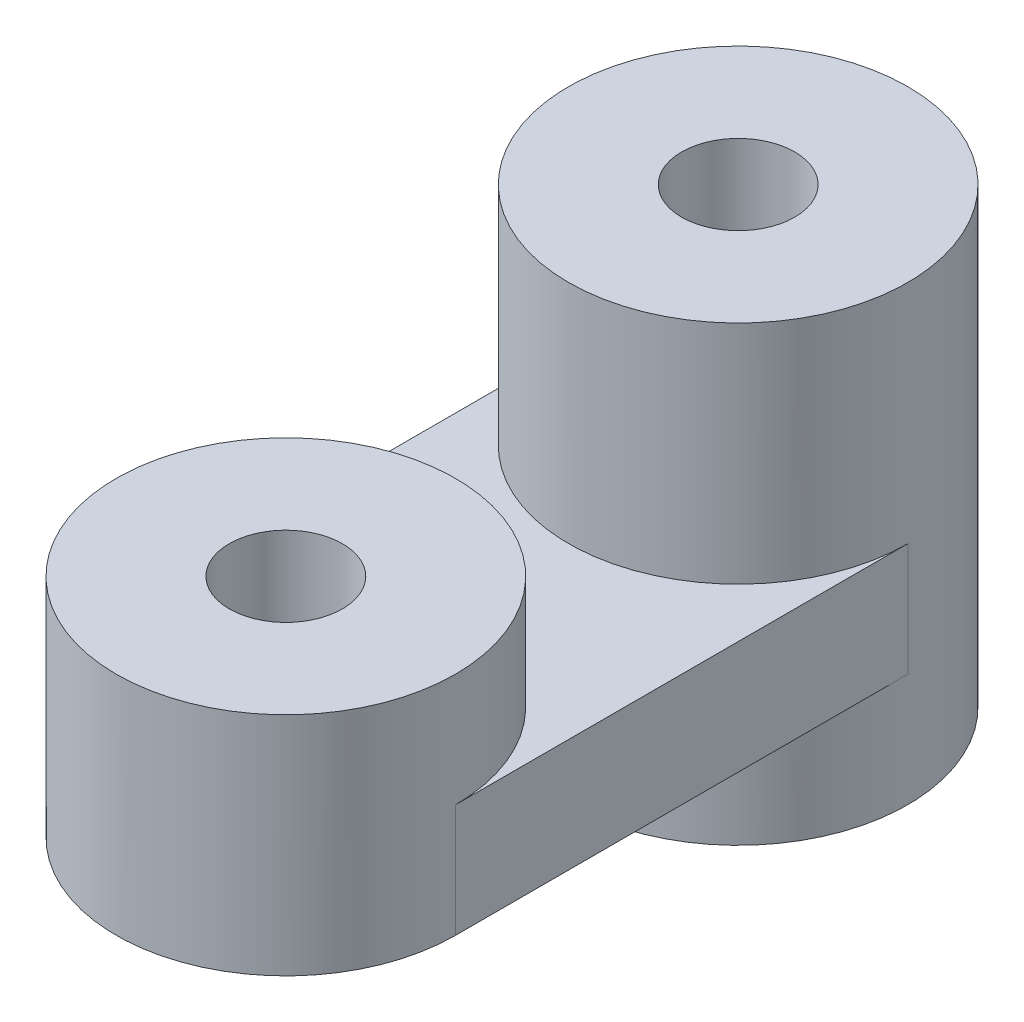
from build123d import *
from build123d.topology import SkipClean

# Parameters (mm, degrees)
CROQUIS1_R              = 2.5
SALIENTE_EXTRUIR1_DEPTH = 5
CROQUIS2_R              = 7.5
CROQUIS2_R_2            = 2.5
SALIENTE_EXTRUIR2_DEPTH = 5
CROQUIS3_R              = 7.5
CROQUIS3_R_2            = 2.5
SALIENTE_EXTRUIR3_DEPTH = 5
SALIENTE_EXTRUIR4_START = 5
CROQUIS4_R              = 2.5
SALIENTE_EXTRUIR4_DEPTH = 5


with BuildPart() as part:
    # Croquis1 → Saliente-Extruir1 (new body)
    with BuildSketch(Plane(origin=(0, 0, 0), x_dir=(1, 0, 0), z_dir=(0, 1, 0))):
        with BuildLine():
            Line((-7.5, 0), (-7.5, 20))
            ThreePointArc((-7.5, 20), (0, 27.5), (7.5, 20))
            Line((7.5, 20), (7.5, 0))
            ThreePointArc((7.5, 0), (0, -7.5), (-7.5, 0))
        make_face()
        with Locations((0, 20)):
            Circle(CROQUIS1_R, mode=Mode.SUBTRACT)
        Circle(CROQUIS1_R, mode=Mode.SUBTRACT)
    extrude(amount=SALIENTE_EXTRUIR1_DEPTH)

    # Croquis2 → Saliente-Extruir2 (add)
    # profile 1 of 2: a face of its own
    with SkipClean():  # the faces are left unmerged after this step: merging them gives an invalid solid
        with BuildSketch(Plane(origin=(0, 5, 0), x_dir=(1, 0, 0), z_dir=(0, 1, 0))):
            Circle(CROQUIS2_R)
            Circle(CROQUIS2_R_2, mode=Mode.SUBTRACT)
        # profile 2 of 2: a face of its own
        with BuildSketch(Plane(origin=(0, 5, 0), x_dir=(1, 0, 0), z_dir=(0, 1, 0))):
            with Locations((0, 20)):
                Circle(CROQUIS2_R)
            with Locations((0, 20)):
                Circle(CROQUIS2_R_2, mode=Mode.SUBTRACT)
        extrude(amount=SALIENTE_EXTRUIR2_DEPTH)

    # Croquis3 → Saliente-Extruir3 (add)
    with BuildSketch(Plane(origin=(0, 10, 0), x_dir=(1, 0, 0), z_dir=(0, 1, 0))):
        with Locations((0, 20)):
            Circle(CROQUIS3_R)
        with Locations((0, 20)):
            Circle(CROQUIS3_R_2, mode=Mode.SUBTRACT)
    extrude(amount=SALIENTE_EXTRUIR3_DEPTH)

    # Croquis4 → Saliente-Extruir4 (add)
    with BuildSketch(Plane.XZ.offset(SALIENTE_EXTRUIR4_START)):
        with BuildLine():
            ThreePointArc((7.5, -20), (0, -12.5), (-7.5, -20))
            ThreePointArc((-7.5, -20), (0, -27.5), (7.5, -20))
        make_face()
        with Locations((0, -20)):
            Circle(CROQUIS4_R, mode=Mode.SUBTRACT)
    extrude(amount=-SALIENTE_EXTRUIR4_DEPTH)


solid = part.part
